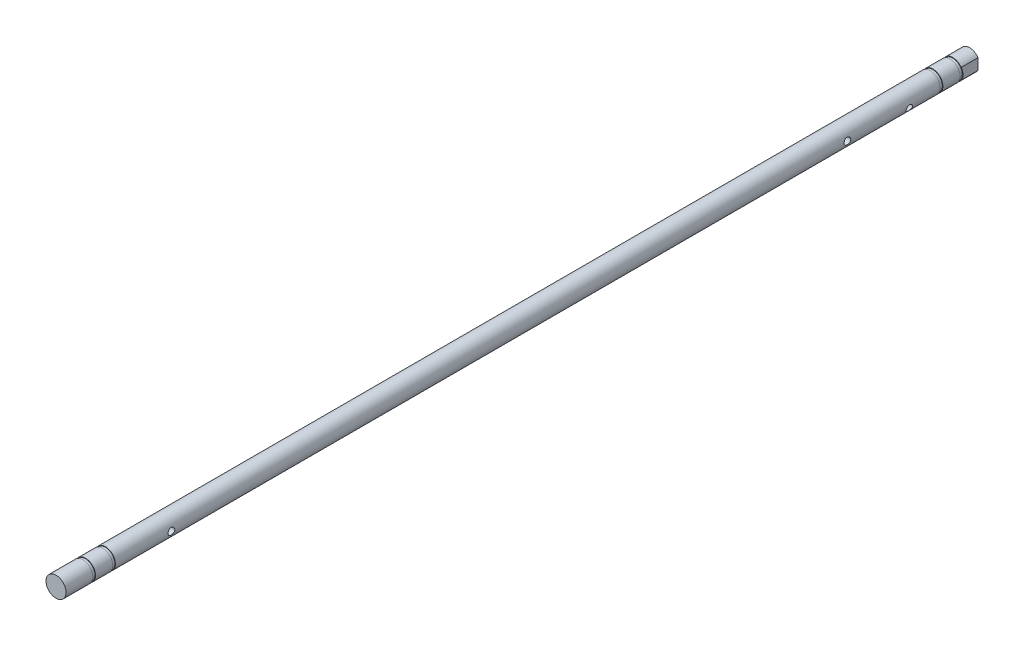
from build123d import *

# Parameters (mm, degrees)
SKETCH1_R                                  = 3
BOSS_EXTRUDE1_DEPTH                        = 275
SKETCH3_W                                  = 0.8
SKETCH3_H                                  = 0.5
CUT_EXTRUDE2_DEPTH                         = 276.032725326
CUT_EXTRUDE2_DEPTH_BACK                    = 276.032725326
SKETCH4_W                                  = 3.470061058
SKETCH4_H                                  = 7
SKETCH4_W_2                                = 2.92528695
CHAMFER1_SIZE                              = 0.3
RETAINING_GROOVES_D5P7_1_START             = 7.05
SKETCH5_R                                  = 2.85
SKETCH5_R_2                                = 2.49
RETAINING_GROOVES_D5P7_1_DEPTH             = 0.8
RETAINING_GROOVES_D5P7_2_START             = 13
SKETCH6_R                                  = 2.85
SKETCH6_R_2                                = 2.49
RETAINING_GROOVES_D5P7_2_DEPTH             = 0.8
RETAINING_GROOVES_D5P7_3_START             = 260.25
SKETCH7_R                                  = 2.85
SKETCH7_R_2                                = 2.49
RETAINING_GROOVES_D5P7_3_DEPTH             = 0.8
RETAINING_GROOVES_D5P7_4_START             = 266.2
SKETCH8_R                                  = 2.85
SKETCH8_R_2                                = 2.49
RETAINING_GROOVES_D5P7_4_DEPTH             = 0.8
TWO_HUB_CROSS_PIN_D2_DEPTH                 = 276.032725326
TWO_HUB_CROSS_PIN_D2_DEPTH_BACK            = 276.032725326
SKETCH9_R                                  = 1
SKETCH10_R                                 = 3.1
REVB_LOWER_SHAFT_NOSE_CLEARANCE_2MM_DEPTH  = 2
REVB_OLDHAM_D2_DRIVE_PIN_CLOCKED_HOLE_OU_W = 1
REVB_OLDHAM_D2_DRIVE_PIN_CLOCKED_HOLE_OU_H = 6.000106441


# Read off the part's stored shape, not the designer's step: RevB_Oldham_D2_Drive_Pin_Clocked_Hole
with BuildPart() as part:
    # Sketch1 → Boss-Extrude1 (new body)
    with BuildSketch(Plane.XY):
        Circle(SKETCH1_R)
    extrude(amount=BOSS_EXTRUDE1_DEPTH)

    # Sketch3 → Cut-Revolve1 (revolve, cut)
    with BuildSketch(Plane(origin=(0, 0, 0), x_dir=(0, 0, -1), z_dir=(1, 0, 0)), mode=Mode.PRIVATE) as cut_revolve1_sk:
        with Locations((-266.6, 2.75)):
            Rectangle(SKETCH3_W, SKETCH3_H)
        with Locations((-260.65, 2.75)):
            Rectangle(SKETCH3_W, SKETCH3_H)
        with Locations((-13.4, 2.75)):
            Rectangle(SKETCH3_W, SKETCH3_H)
        with Locations((-7.45, 2.75)):
            Rectangle(SKETCH3_W, SKETCH3_H)
    revolve(cut_revolve1_sk.sketch.rotate(Axis((0, 0, 263.365004794), (0, 0, -1)), 90), axis=Axis((0, 0, 263.365004794), (0, 0, -1)), mode=Mode.SUBTRACT)

    # Sketch4 → Cut-Extrude2 (cut, two sides: drawn at the far end of the back side and taken through both)
    with BuildSketch(Plane(origin=(0, 0, 0), x_dir=(1, 0, 0), z_dir=(0, 1, 0)).offset(-CUT_EXTRUDE2_DEPTH_BACK)):
        with Locations((4.235030529, -3.5)):
            Rectangle(SKETCH4_W, SKETCH4_H)
        with Locations((-3.962643475, -3.5)):
            Rectangle(SKETCH4_W_2, SKETCH4_H)
    extrude(amount=CUT_EXTRUDE2_DEPTH + CUT_EXTRUDE2_DEPTH_BACK, mode=Mode.SUBTRACT)

    # Chamfer1
    chamfer1_edges = [part.edges().sort_by_distance(p)[0] for p in [
        (0, 3, 0),
        (0, -3, 0),
    ]]
    chamfer(chamfer1_edges, length=CHAMFER1_SIZE)

    # Sketch5 → Retaining_Grooves_D5p7_1 (add)
    with BuildSketch(Plane.XY.offset(RETAINING_GROOVES_D5P7_1_START)):
        Circle(SKETCH5_R)
        Circle(SKETCH5_R_2, mode=Mode.SUBTRACT)
    extrude(amount=RETAINING_GROOVES_D5P7_1_DEPTH)

    # Sketch6 → Retaining_Grooves_D5p7_2 (add)
    with BuildSketch(Plane.XY.offset(RETAINING_GROOVES_D5P7_2_START)):
        Circle(SKETCH6_R)
        Circle(SKETCH6_R_2, mode=Mode.SUBTRACT)
    extrude(amount=RETAINING_GROOVES_D5P7_2_DEPTH)

    # Sketch7 → Retaining_Grooves_D5p7_3 (add)
    with BuildSketch(Plane.XY.offset(RETAINING_GROOVES_D5P7_3_START)):
        Circle(SKETCH7_R)
        Circle(SKETCH7_R_2, mode=Mode.SUBTRACT)
    extrude(amount=RETAINING_GROOVES_D5P7_3_DEPTH)

    # Sketch8 → Retaining_Grooves_D5p7_4 (add)
    with BuildSketch(Plane.XY.offset(RETAINING_GROOVES_D5P7_4_START)):
        Circle(SKETCH8_R)
        Circle(SKETCH8_R_2, mode=Mode.SUBTRACT)
    extrude(amount=RETAINING_GROOVES_D5P7_4_DEPTH)

    # Sketch9 → Two_Hub_Cross_Pin_D2 (cut, two sides: drawn at the far end of the back side and taken through both)
    with BuildSketch(Plane(origin=(0, 0, 0), x_dir=(0, 0, -1), z_dir=(1, 0, 0)).offset(-TWO_HUB_CROSS_PIN_D2_DEPTH_BACK)):
        with Locations((-41.5, 0)):
            Circle(SKETCH9_R)
        with Locations((-243.5, 0)):
            Circle(SKETCH9_R)
    extrude(amount=TWO_HUB_CROSS_PIN_D2_DEPTH + TWO_HUB_CROSS_PIN_D2_DEPTH_BACK, mode=Mode.SUBTRACT)

    # Sketch10 → RevB_Lower_Shaft_Nose_Clearance_2mm (cut)
    with BuildSketch(Plane(origin=(0, 0, 0), x_dir=(-1, 0, 0), z_dir=(0, 0, -1))):
        Circle(SKETCH10_R)
    extrude(amount=-REVB_LOWER_SHAFT_NOSE_CLEARANCE_2MM_DEPTH, mode=Mode.SUBTRACT)

    # RevB_Oldham_D2_Drive_Pin_Clocked_Hole ou → RevB_Oldham_D2_Drive_Pin_Clocked_Hole (revolve, cut)
    with BuildSketch(Plane(origin=(0, 0, 22.925), x_dir=(0.2727065426398811, 0.962097262027807, 0), z_dir=(0, 0, -1))):
        with Locations((0.5, 2.6843e-05)):
            Rectangle(REVB_OLDHAM_D2_DRIVE_PIN_CLOCKED_HOLE_OU_W, REVB_OLDHAM_D2_DRIVE_PIN_CLOCKED_HOLE_OU_H)
    revolve(axis=Axis((0, 0, 22.925), (0.962097262027807, -0.2727065426398811, 0)), mode=Mode.SUBTRACT)


solid = part.part
